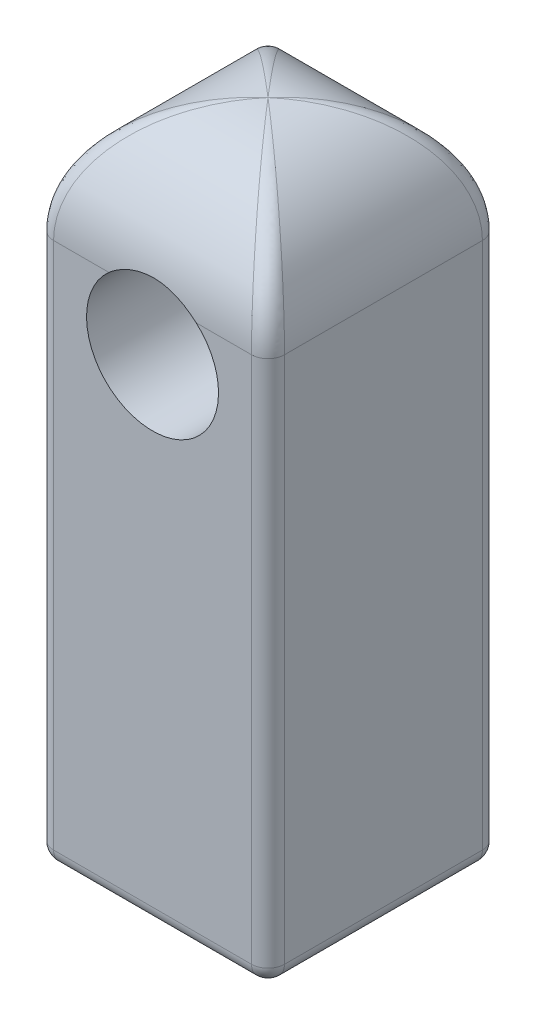
from build123d import *

# Parameters (mm, degrees)
SKETCH1_W           = 7
SKETCH1_H           = 20
SKETCH1_R           = 2
BOSS_EXTRUDE1_DEPTH = 3.5
FILLET1_R           = 3.5
FILLET2_R           = 0.5


with BuildPart() as part:
    # Sketch1 → Boss-Extrude1 (new, symmetric)
    with BuildSketch(Plane.XY):
        with Locations((0, -5)):
            Rectangle(SKETCH1_W, SKETCH1_H)
        Circle(SKETCH1_R, mode=Mode.SUBTRACT)
    extrude(amount=BOSS_EXTRUDE1_DEPTH, both=True)

    # Fillet1
    # the kernel refuses this fillet: 3.5 mm, written as the material it takes off along each edge
    with BuildSketch(Plane(origin=(-12.25, 5, 3.5), x_dir=(0, 0, -1), z_dir=(1, 0, 0)), Plane(origin=(-3.5, 5, -12.25), x_dir=(1, 0, 0), z_dir=(0, 0, 1)), Plane(origin=(3.5, 5, 12.25), x_dir=(-1, 0, 0), z_dir=(0, 0, -1))) as fillet1_piece_1:
        with BuildLine():
            CenterArc((FILLET1_R, -FILLET1_R), FILLET1_R, 90, 90)
            Line((0, -FILLET1_R), (0, 0))
            Line((0, 0), (FILLET1_R, 0))
        make_face()
    extrude(amount=24.5, mode=Mode.SUBTRACT)
    with BuildSketch(Plane(origin=(-12.25, 5, -3.5), x_dir=(0, 0, 1), z_dir=(1, 0, 0))) as fillet1_piece_2:
        with BuildLine():
            CenterArc((FILLET1_R, FILLET1_R), FILLET1_R, 180, 90)
            Line((0, FILLET1_R), (0, 0))
            Line((0, 0), (FILLET1_R, 0))
        make_face()
    extrude(amount=24.5, mode=Mode.SUBTRACT)

    # Fillet2
    fillet2_edges = [part.edges().sort_by_distance(p)[0] for p in [
        (3.5, -6.75, 3.5),
        (-3.5, -6.75, 3.5),
        (-3.5, -6.75, -3.5),
        (-2.261171176, 4.171536059, 2.261171176),
        (-2.261171176, 4.171536059, -2.261171176),
        (2.261171176, 4.171536059, 2.261171176),
        (2.261171176, 4.171536059, -2.261171176),
        (3.5, -6.75, -3.5),
        (0, -15, -3.5),
        (0, -15, 3.5),
        (3.5, -15, 0),
        (-3.5, -15, 0),
    ]]
    fillet(fillet2_edges, radius=FILLET2_R)


solid = part.part
